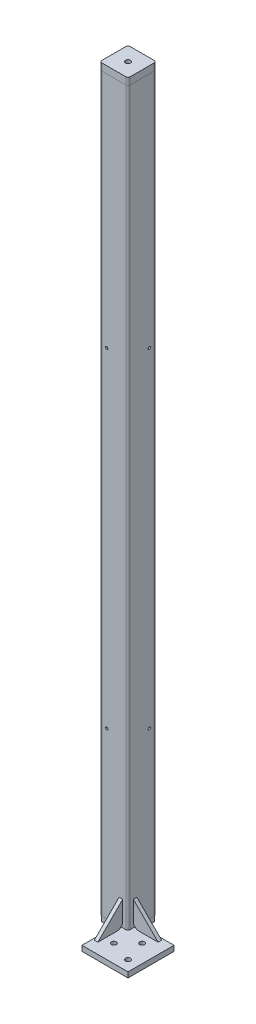
from build123d import *

# Parameters (mm, degrees)
MEMBER_1_DEPTH                   = 2065
EXTRUDE_1_DEPTH                  = 15
HOLE_WIZARD_14_0_14_1_AT_2_COUNT = 2
HOLE_WIZARD_14_0_14_1_AT_2_PITCH = 63.245553203
HOLE_WIZARD_14_0_14_1_AT_3_COUNT = 2
HOLE_WIZARD_14_0_14_1_AT_3_PITCH = 63.245553203
EXTRUDE_2_DEPTH                  = 10
EXTRUDE_3_DEPTH                  = 10
CHAMFER_1_SIZE                   = 5
EXTRUDE_6_DEPTH                  = 20
HOLE_START                       = 36
HOLE_WIZARD_M8_1_OUTLINE_R       = 3.4
HOLE_WIZARD_M8_1_DEPTH           = 4
HOLE_WIZARD_M8_2_OUTLINE_R       = 3.4
HOLE_WIZARD_M8_2_DEPTH           = 4
HOLE_WIZARD_M8_3_AT_2_COUNT      = 2
HOLE_WIZARD_M8_3_AT_2_PITCH      = 101.45
HOLE_WIZARD_M8_3_AT_3_COUNT      = 2
HOLE_WIZARD_M8_3_AT_3_PITCH      = 202.9


# Read off the part's stored shape, not the designer's step: M8 螺纹孔1, M8 螺纹孔2
with BuildPart() as part:
    # Sketch11 → Member 1 (new body)
    with BuildSketch(Plane(origin=(0, 0, 0), x_dir=(-1, 0, 0), z_dir=(0, 1, 0))):
        with BuildLine():
            Line((-34, -40), (34, -40))
            ThreePointArc((34, -40), (38.242640687, -38.242640687), (40, -34))
            Line((40, -34), (40, 34))
            ThreePointArc((40, 34), (38.242640687, 38.242640687), (34, 40))
            Line((34, 40), (-34, 40))
            ThreePointArc((-34, 40), (-38.242640687, 38.242640687), (-40, 34))
            Line((-40, 34), (-40, -34))
            ThreePointArc((-40, -34), (-38.242640687, -38.242640687), (-34, -40))
        make_face()
        with BuildLine():
            Line((-34, -36), (34, -36))
            ThreePointArc((34, -36), (35.414213562, -35.414213562), (36, -34))
            Line((36, -34), (36, 34))
            ThreePointArc((36, 34), (35.414213562, 35.414213562), (34, 36))
            Line((34, 36), (-34, 36))
            ThreePointArc((-34, 36), (-35.414213562, 35.414213562), (-36, 34))
            Line((-36, 34), (-36, -34))
            ThreePointArc((-36, -34), (-35.414213562, -35.414213562), (-34, -36))
        make_face(mode=Mode.SUBTRACT)
    extrude(amount=MEMBER_1_DEPTH)

    # M8 螺纹孔1 outline → M8 螺纹孔1 (cut)
    with BuildSketch(Plane.XY.offset(HOLE_START)):
        with Locations((-20, 465)):
            Circle(HOLE_WIZARD_M8_1_OUTLINE_R)
        with Locations((-20, 1395)):
            Circle(HOLE_WIZARD_M8_1_OUTLINE_R)
    extrude(amount=HOLE_WIZARD_M8_1_DEPTH, mode=Mode.SUBTRACT)

    # M8 螺纹孔2 outline → M8 螺纹孔2 (cut)
    with BuildSketch(Plane.YZ.offset(HOLE_START)):
        with Locations((465, -20.000000001)):
            Circle(HOLE_WIZARD_M8_2_OUTLINE_R)
        with Locations((1395, -20.000000001)):
            Circle(HOLE_WIZARD_M8_2_OUTLINE_R)
    extrude(amount=HOLE_WIZARD_M8_2_DEPTH, mode=Mode.SUBTRACT)

    # 草图33 → M8 螺纹孔3 (revolve, cut)
    with BuildSketch(Plane(origin=(-40, 820.8, 25), x_dir=(0, 0, 1), z_dir=(0, 1, 0))):
        Polygon((0, 0), (0, 24.292926105), (3.4, 22.25), (3.4, 0), align=None)
    hole_wizard_m8_3 = revolve(axis=Axis((-46.35, 820.8, 25), (1, 0, 0)), mode=Mode.SUBTRACT)

    # M8 螺纹孔3 at 2: M8 螺纹孔3 ×2
    with Locations(*[(0, i * HOLE_WIZARD_M8_3_AT_2_PITCH, 0) for i in range(1, HOLE_WIZARD_M8_3_AT_2_COUNT)]):
        add(hole_wizard_m8_3, mode=Mode.SUBTRACT)

    # M8 螺纹孔3 at 3: M8 螺纹孔3 ×2
    with Locations(*[(0, i * HOLE_WIZARD_M8_3_AT_3_PITCH, 0) for i in range(1, HOLE_WIZARD_M8_3_AT_3_COUNT)]):
        add(hole_wizard_m8_3, mode=Mode.SUBTRACT)


with BuildPart() as body_2:
    # 草图3 → 凸台-拉伸1 (new body)
    with BuildSketch(Plane.XZ):
        Polygon((10, 40), (10, 140), (140, 140), (140, 10), (40, 10), (40, -40), (-40, -40), (-40, 40), align=None)
    extrude(amount=EXTRUDE_1_DEPTH)

    # 草图4 → Ø14.0 (14) 直径孔1 (revolve, cut)
    with BuildSketch(Plane(origin=(110, 0, 110), x_dir=(0, 0, 1), z_dir=(1, 0, 0))):
        Polygon((0, 0), (0, 44.206024333), (7, 40), (7, 0), align=None)
    hole_wizard_14_0_14_1 = revolve(axis=Axis((110, 6.35, 110), (0, -1, 0)), mode=Mode.SUBTRACT)

    # Ø14.0 (14) 直径孔1 at 2: Ø14.0 (14) 直径孔1 ×2
    with Locations(*[Vector(-0.9486832980505139, 0, -0.316227766016838) * (i * HOLE_WIZARD_14_0_14_1_AT_2_PITCH) for i in range(1, HOLE_WIZARD_14_0_14_1_AT_2_COUNT)]):
        add(hole_wizard_14_0_14_1, mode=Mode.SUBTRACT)

    # Ø14.0 (14) 直径孔1 at 3: Ø14.0 (14) 直径孔1 ×2
    with Locations(*[Vector(-0.3162277660168379, 0, -0.9486832980505139) * (i * HOLE_WIZARD_14_0_14_1_AT_3_PITCH) for i in range(1, HOLE_WIZARD_14_0_14_1_AT_3_COUNT)]):
        add(hole_wizard_14_0_14_1, mode=Mode.SUBTRACT)

    # 倒角1
    chamfer_1_edges = [body_2.edges().sort_by_distance(p)[0] for p in [
        (-40, -7.5, 40),
        (40, -7.5, -40),
        (-40, -7.5, -40),
    ]]
    chamfer(chamfer_1_edges, length=CHAMFER_1_SIZE)


with BuildPart() as body_3:
    # 草图6 → 凸台-拉伸2 (new body)
    with BuildSketch(Plane.ZY.offset(-25)):
        Polygon((40, 70), (110, 0), (50, 0), (40, 10), align=None)
    extrude(amount=EXTRUDE_2_DEPTH)


with BuildPart() as body_4:
    # 草图7 → 凸台-拉伸3 (new body)
    with BuildSketch(Plane(origin=(0, 0, 25), x_dir=(-1, 0, 0), z_dir=(0, 0, -1))):
        Polygon((-40, 70), (-40, 10), (-50, 0), (-110, 0), align=None)
    extrude(amount=EXTRUDE_3_DEPTH)


with BuildPart() as body_5:
    # 草图26 → 凸台-拉伸6 (new body)
    with BuildSketch(Plane(origin=(0, 2065, 0), x_dir=(1, 0, 0), z_dir=(0, 1, 0))):
        with BuildLine():
            Line((-34, -40), (34, -40))
            ThreePointArc((34, -40), (38.242640687, -38.242640687), (40, -34))
            Line((40, -34), (40, 34))
            ThreePointArc((40, 34), (38.242640687, 38.242640687), (34, 40))
            Line((34, 40), (-34, 40))
            ThreePointArc((-34, 40), (-38.242640687, 38.242640687), (-40, 34))
            Line((-40, 34), (-40, -34))
            ThreePointArc((-40, -34), (-38.242640687, -38.242640687), (-34, -40))
        make_face()
    extrude(amount=EXTRUDE_6_DEPTH)

    # 草图27 → M16 螺纹孔1 (revolve, cut)
    with BuildSketch(Plane(origin=(0, 2085, 0), x_dir=(0, 0, 1), z_dir=(1, 0, 0))):
        Polygon((0, 0), (0, 46.206024333), (7, 42), (7, 0), align=None)
    revolve(axis=Axis((0, 2091.35, 0), (0, -1, 0)), mode=Mode.SUBTRACT)


solid = Compound([part.part, body_2.part, body_3.part, body_4.part, body_5.part])
